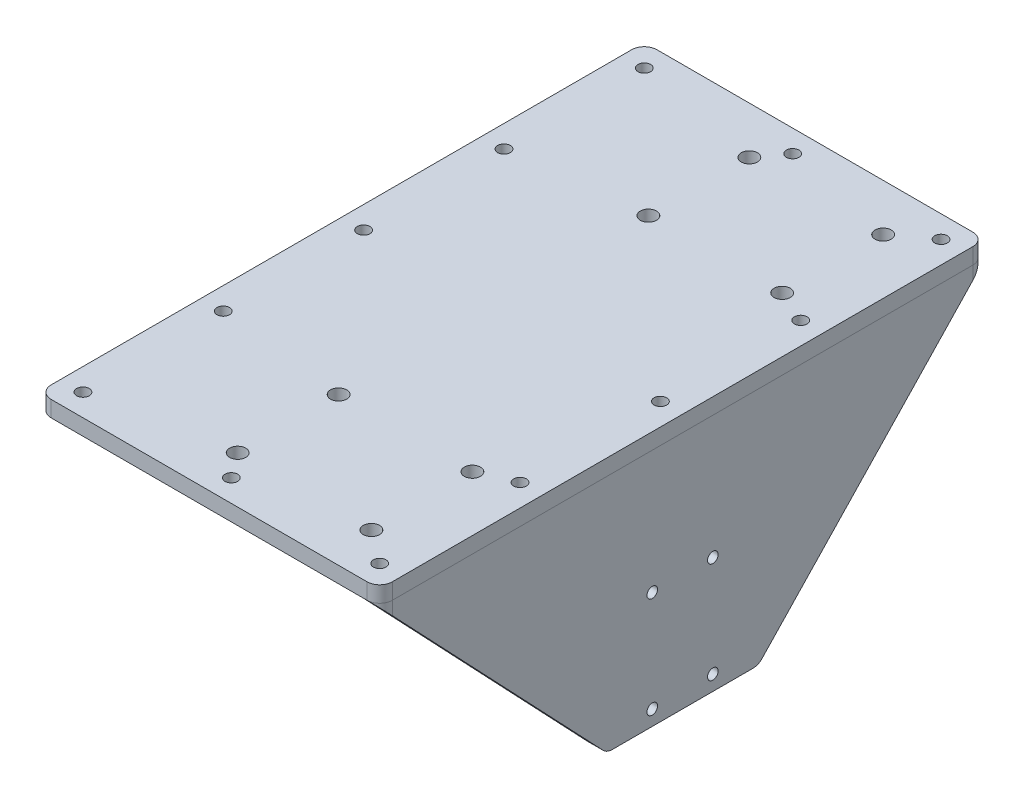
from build123d import *

# Parameters (mm, degrees)
BOSS_EXTRUDE1_DEPTH     = 120
CUT_EXTRUDE1_DEPTH      = 120
CUT_EXTRUDE2_DEPTH      = 171.873354052
CUT_EXTRUDE2_DEPTH_BACK = 171.873354052
SKETCH4_R               = 2.5
FILLET1_R               = 5
SKETCH5_R               = 2.1
CUT_EXTRUDE3_DEPTH      = 10
SPLIT1_SURFACE_1_BACK   = 294.423
SPLIT1_SURFACE_1_DEPTH  = 588.846
SPLIT1_SURFACE_2_BACK   = 294.423
SPLIT1_SURFACE_2_DEPTH  = 588.846
CUT_EXTRUDE4_DEPTH      = 168.19276487
CUT_EXTRUDE4_DEPTH_BACK = 168.19276487
SKETCH7_R               = 3.2


with BuildPart() as part:
    # Sketch1 → Boss-Extrude1 (new, symmetric)
    with BuildSketch(Plane.XY):
        Polygon((67.575, 0), (-67.575, 0), (-67.575, -101.15), (-61.225, -101.15), (-61.225, -6.35), (67.575, -6.35), align=None)
    extrude(amount=BOSS_EXTRUDE1_DEPTH, both=True)

    # Sketch2 → Cut-Extrude1 (cut, symmetric)
    with BuildSketch(Plane(origin=(-61.225, 0, 0), x_dir=(0, 0, -1), z_dir=(1, 0, 0))):
        Polygon((-120, -6.35), (-30, -101.15), (30, -101.15), (120, -6.35), (120, -206.35), (-120, -206.35), align=None)
    extrude(amount=CUT_EXTRUDE1_DEPTH, both=True, mode=Mode.SUBTRACT)

    # Sketch4 → Cut-Extrude2 (cut, two sides: drawn at the far end of the back side and taken through both)
    with BuildSketch(Plane(origin=(0, 0, 0), x_dir=(1, 0, 0), z_dir=(0, 1, 0)).offset(-CUT_EXTRUDE2_DEPTH_BACK)):
        with Locations(Location((-58.785, 111.21, 0), (0, 0, 192.578118656))):
            Circle(SKETCH4_R)
        with Locations(Location((58.785, 111.21, 0), (0, 0, 270))):
            Circle(SKETCH4_R)
        with Locations(Location((58.785, 55.605, 0), (0, 0, 270))):
            Circle(SKETCH4_R)
        with Locations(Location((-58.785, 55.605, 0), (0, 0, 192.578118656))):
            Circle(SKETCH4_R)
        with Locations(Location((-58.785, 0, 0), (0, 0, 192.578118656))):
            Circle(SKETCH4_R)
        with Locations(Location((58.785, 0, 0), (0, 0, 270))):
            Circle(SKETCH4_R)
        with Locations(Location((-58.785, -55.605, 0), (0, 0, 192.578118656))):
            Circle(SKETCH4_R)
        with Locations(Location((58.785, -55.605, 0), (0, 0, 270))):
            Circle(SKETCH4_R)
        with Locations(Location((58.785, -111.21, 0), (0, 0, 270))):
            Circle(SKETCH4_R)
        with Locations(Location((-58.785, -111.21, 0), (0, 0, 192.578118656))):
            Circle(SKETCH4_R)
        with Locations(Location((0, 111.21, 0), (0, 0, 270))):
            Circle(SKETCH4_R)
        with Locations(Location((0, -111.21, 0), (0, 0, 270))):
            Circle(SKETCH4_R)
    extrude(amount=CUT_EXTRUDE2_DEPTH + CUT_EXTRUDE2_DEPTH_BACK, mode=Mode.SUBTRACT)

    # Fillet1
    fillet1_edges = [part.edges().sort_by_distance(p)[0] for p in [
        (-67.575, -3.175, 120),
        (-64.4, -101.15, 30),
        (-64.4, -101.15, -30),
        (67.575, -3.175, 120),
        (-67.575, -3.175, -120),
        (67.575, -3.175, -120),
    ]]
    fillet(fillet1_edges, radius=FILLET1_R)

    # Sketch5 → Cut-Extrude3 (cut)
    with BuildSketch(Plane.ZY.offset(67.575)):
        with Locations(Location((12, -55.15, 0), (0, 0, 270))):
            Circle(SKETCH5_R)
        with Locations(Location((-12, -55.15, 0), (0, 0, 270))):
            Circle(SKETCH5_R)
        with Locations(Location((-12, -95.15, 0), (0, 0, 270))):
            Circle(SKETCH5_R)
        with Locations(Location((12, -95.15, 0), (0, 0, 270))):
            Circle(SKETCH5_R)
    extrude(amount=-CUT_EXTRUDE3_DEPTH, mode=Mode.SUBTRACT)


with BuildPart() as body_2:
    # Split1: the piece behind the surface
    add(part.part)
    # Split1 surface: a surface, the sketch's curves swept straight by 588.846 mm
    with BuildLine(Plane(origin=(0, 0, -120), x_dir=(-1, 0, 0), z_dir=(0, 0, -1)).offset(-SPLIT1_SURFACE_1_BACK), mode=Mode.PRIVATE) as split1_surface_1_path:
        Line((-62.575, -6.35), (107.675385549, -6.35))
    split1_surface_1 = Shell.extrude(split1_surface_1_path.wire(), (0 * SPLIT1_SURFACE_1_DEPTH, 0 * SPLIT1_SURFACE_1_DEPTH, -1 * SPLIT1_SURFACE_1_DEPTH))
    split(bisect_by=split1_surface_1, keep=Keep.BOTTOM)


with BuildPart() as part_1:
    add(part.part)

    # Split1: split by a surface, the side it looks to stays
    # Split1 surface: a surface, the sketch's curves swept straight by 588.846 mm
    with BuildLine(Plane(origin=(0, 0, -120), x_dir=(-1, 0, 0), z_dir=(0, 0, -1)).offset(-SPLIT1_SURFACE_2_BACK), mode=Mode.PRIVATE) as split1_surface_2_path:
        Line((-62.575, -6.35), (107.675385549, -6.35))
    split1_surface_2 = Shell.extrude(split1_surface_2_path.wire(), (0 * SPLIT1_SURFACE_2_DEPTH, 0 * SPLIT1_SURFACE_2_DEPTH, -1 * SPLIT1_SURFACE_2_DEPTH))
    split(bisect_by=split1_surface_2, keep=Keep.TOP)

    # Sketch7 → Cut-Extrude4 (cut, two sides: drawn at the far end of the back side and taken through both)
    with BuildSketch(Plane.XZ.offset(6.35).offset(-CUT_EXTRUDE4_DEPTH_BACK)):
        with Locations(Location((-7.325, 101.37, 0), (0, 0, 270))):
            Circle(SKETCH7_R)
        with Locations(Location((45.675, 101.37, 0), (0, 0, 270))):
            Circle(SKETCH7_R)
        with Locations(Location((45.675, 61.37, 0), (0, 0, 270))):
            Circle(SKETCH7_R)
        with Locations(Location((-7.325, 61.37, 0), (0, 0, 270))):
            Circle(SKETCH7_R)
        with Locations(Location((-7.325, -61.37, 0), (0, 0, 270))):
            Circle(SKETCH7_R)
        with Locations(Location((45.675, -61.37, 0), (0, 0, 270))):
            Circle(SKETCH7_R)
        with Locations(Location((-7.325, -101.37, 0), (0, 0, 270))):
            Circle(SKETCH7_R)
        with Locations(Location((45.675, -101.37, 0), (0, 0, 270))):
            Circle(SKETCH7_R)
    extrude(amount=CUT_EXTRUDE4_DEPTH + CUT_EXTRUDE4_DEPTH_BACK, mode=Mode.SUBTRACT)


with BuildPart() as body_3:
    # Mirror1: read off the stored shape, not the designer's step
    # Mirror1: mirrored copy
    add(body_2.part.mirror(Plane.YZ))


solid = Compound([part_1.part, body_3.part])
